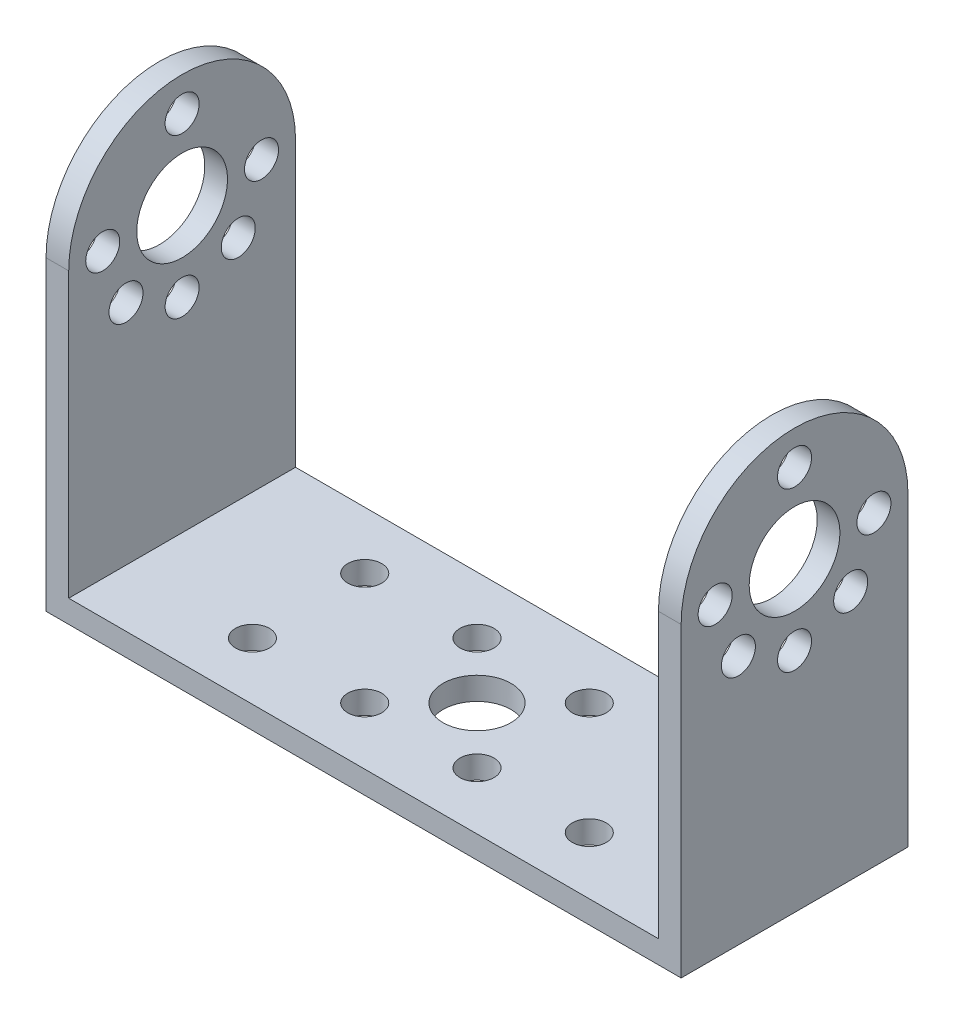
from build123d import *

# Parameters (mm, degrees)
SKETCH_1_W          = 56
SKETCH_1_H          = 20
EXTRUDE_1_DEPTH     = 2
CUT_EXTRUDE_1_REACH = 61.498
SKETCH_2_R          = 3
SKETCH_2_R_2        = 1.5
EXTRUDE_2_DEPTH     = 2
CUT_EXTRUDE_2_REACH = 72.036
SKETCH_4_R          = 4
SKETCH_4_R_2        = 1.5


with BuildPart() as part:
    # 草图1 → 凸台-拉伸1 (new body)
    with BuildSketch(Plane(origin=(0, 0, 0), x_dir=(1, 0, 0), z_dir=(0, 1, 0))):
        with Locations((28, 10)):
            Rectangle(SKETCH_1_W, SKETCH_1_H)
    extrude(amount=EXTRUDE_1_DEPTH)

    # 草图2 → 切除-拉伸1 (cut, up to next)
    with BuildSketch(Plane(origin=(0, 2, 0), x_dir=(1, 0, 0), z_dir=(0, 1, 0)), mode=Mode.PRIVATE) as cut_extrude_1_sk1:
        with Locations((28, 10)):
            Circle(SKETCH_2_R)
    cut_extrude_1_tool1 = extrude(cut_extrude_1_sk1.sketch, amount=-CUT_EXTRUDE_1_REACH, mode=Mode.PRIVATE) & part.part
    # 草图2 → 切除-拉伸1 (cut, up to next)
    with BuildSketch(Plane(origin=(0, 2, 0), x_dir=(1, 0, 0), z_dir=(0, 1, 0)), mode=Mode.PRIVATE) as cut_extrude_1_sk2:
        with Locations((32.949747468, 5.050252532)):
            Circle(SKETCH_2_R_2)
    cut_extrude_1_tool2 = extrude(cut_extrude_1_sk2.sketch, amount=-CUT_EXTRUDE_1_REACH, mode=Mode.PRIVATE) & part.part
    # 草图2 → 切除-拉伸1 (cut, up to next)
    with BuildSketch(Plane(origin=(0, 2, 0), x_dir=(1, 0, 0), z_dir=(0, 1, 0)), mode=Mode.PRIVATE) as cut_extrude_1_sk3:
        with Locations((23.050252532, 5.050252532)):
            Circle(SKETCH_2_R_2)
    cut_extrude_1_tool3 = extrude(cut_extrude_1_sk3.sketch, amount=-CUT_EXTRUDE_1_REACH, mode=Mode.PRIVATE) & part.part
    # 草图2 → 切除-拉伸1 (cut, up to next)
    with BuildSketch(Plane(origin=(0, 2, 0), x_dir=(1, 0, 0), z_dir=(0, 1, 0)), mode=Mode.PRIVATE) as cut_extrude_1_sk4:
        with Locations((23.050252532, 14.949747468)):
            Circle(SKETCH_2_R_2)
    cut_extrude_1_tool4 = extrude(cut_extrude_1_sk4.sketch, amount=-CUT_EXTRUDE_1_REACH, mode=Mode.PRIVATE) & part.part
    # 草图2 → 切除-拉伸1 (cut, up to next)
    with BuildSketch(Plane(origin=(0, 2, 0), x_dir=(1, 0, 0), z_dir=(0, 1, 0)), mode=Mode.PRIVATE) as cut_extrude_1_sk5:
        with Locations((32.949747468, 14.949747468)):
            Circle(SKETCH_2_R_2)
    cut_extrude_1_tool5 = extrude(cut_extrude_1_sk5.sketch, amount=-CUT_EXTRUDE_1_REACH, mode=Mode.PRIVATE) & part.part
    # 草图2 → 切除-拉伸1 (cut, up to next)
    with BuildSketch(Plane(origin=(0, 2, 0), x_dir=(1, 0, 0), z_dir=(0, 1, 0)), mode=Mode.PRIVATE) as cut_extrude_1_sk6:
        with Locations((13.150757595, 14.949747468)):
            Circle(SKETCH_2_R_2)
    cut_extrude_1_tool6 = extrude(cut_extrude_1_sk6.sketch, amount=-CUT_EXTRUDE_1_REACH, mode=Mode.PRIVATE) & part.part
    # 草图2 → 切除-拉伸1 (cut, up to next)
    with BuildSketch(Plane(origin=(0, 2, 0), x_dir=(1, 0, 0), z_dir=(0, 1, 0)), mode=Mode.PRIVATE) as cut_extrude_1_sk7:
        with Locations((13.150757595, 5.050252532)):
            Circle(SKETCH_2_R_2)
    cut_extrude_1_tool7 = extrude(cut_extrude_1_sk7.sketch, amount=-CUT_EXTRUDE_1_REACH, mode=Mode.PRIVATE) & part.part
    # 草图2 → 切除-拉伸1 (cut, up to next)
    with BuildSketch(Plane(origin=(0, 2, 0), x_dir=(1, 0, 0), z_dir=(0, 1, 0)), mode=Mode.PRIVATE) as cut_extrude_1_sk8:
        with Locations((42.849242405, 5.050252532)):
            Circle(SKETCH_2_R_2)
    cut_extrude_1_tool8 = extrude(cut_extrude_1_sk8.sketch, amount=-CUT_EXTRUDE_1_REACH, mode=Mode.PRIVATE) & part.part
    # 草图2 → 切除-拉伸1 (cut, up to next)
    with BuildSketch(Plane(origin=(0, 2, 0), x_dir=(1, 0, 0), z_dir=(0, 1, 0)), mode=Mode.PRIVATE) as cut_extrude_1_sk9:
        with Locations((42.849242405, 14.949747468)):
            Circle(SKETCH_2_R_2)
    cut_extrude_1_tool9 = extrude(cut_extrude_1_sk9.sketch, amount=-CUT_EXTRUDE_1_REACH, mode=Mode.PRIVATE) & part.part
    add(cut_extrude_1_tool1.solids().sort_by_distance((28, 2, -10))[0], mode=Mode.SUBTRACT)
    add(cut_extrude_1_tool2.solids().sort_by_distance((32.949747, 2, -5.050253))[0], mode=Mode.SUBTRACT)
    add(cut_extrude_1_tool3.solids().sort_by_distance((23.050253, 2, -5.050253))[0], mode=Mode.SUBTRACT)
    add(cut_extrude_1_tool4.solids().sort_by_distance((23.050253, 2, -14.949747))[0], mode=Mode.SUBTRACT)
    add(cut_extrude_1_tool5.solids().sort_by_distance((32.949747, 2, -14.949747))[0], mode=Mode.SUBTRACT)
    add(cut_extrude_1_tool6.solids().sort_by_distance((13.150758, 2, -14.949747))[0], mode=Mode.SUBTRACT)
    add(cut_extrude_1_tool7.solids().sort_by_distance((13.150758, 2, -5.050253))[0], mode=Mode.SUBTRACT)
    add(cut_extrude_1_tool8.solids().sort_by_distance((42.849242, 2, -5.050253))[0], mode=Mode.SUBTRACT)
    add(cut_extrude_1_tool9.solids().sort_by_distance((42.849242, 2, -14.949747))[0], mode=Mode.SUBTRACT)

    # 草图3 → 凸台-拉伸2 (add)
    with BuildSketch(Plane.ZY):
        with BuildLine():
            Line((-20, 2), (0, 2))
            Line((0, 2), (0, 27))
            ThreePointArc((0, 27), (-10, 37), (-20, 27))
            Line((-20, 27), (-20, 2))
        make_face()
    extrude_2 = extrude(amount=-EXTRUDE_2_DEPTH)

    # 草图4 → 切除-拉伸2 (cut, up to next)
    with BuildSketch(Plane.ZY, mode=Mode.PRIVATE) as cut_extrude_2_sk1:
        with Locations((-10, 27)):
            Circle(SKETCH_4_R)
    cut_extrude_2_tool1 = extrude(cut_extrude_2_sk1.sketch, amount=-CUT_EXTRUDE_2_REACH, mode=Mode.PRIVATE) & part.part
    # 草图4 → 切除-拉伸2 (cut, up to next)
    with BuildSketch(Plane.ZY, mode=Mode.PRIVATE) as cut_extrude_2_sk2:
        with Locations((-10, 34)):
            Circle(SKETCH_4_R_2)
    cut_extrude_2_tool2 = extrude(cut_extrude_2_sk2.sketch, amount=-CUT_EXTRUDE_2_REACH, mode=Mode.PRIVATE) & part.part
    # 草图4 → 切除-拉伸2 (cut, up to next)
    with BuildSketch(Plane.ZY, mode=Mode.PRIVATE) as cut_extrude_2_sk3:
        with Locations((-3, 27)):
            Circle(SKETCH_4_R_2)
    cut_extrude_2_tool3 = extrude(cut_extrude_2_sk3.sketch, amount=-CUT_EXTRUDE_2_REACH, mode=Mode.PRIVATE) & part.part
    # 草图4 → 切除-拉伸2 (cut, up to next)
    with BuildSketch(Plane.ZY, mode=Mode.PRIVATE) as cut_extrude_2_sk4:
        with Locations((-5.050252532, 22.050252532)):
            Circle(SKETCH_4_R_2)
    cut_extrude_2_tool4 = extrude(cut_extrude_2_sk4.sketch, amount=-CUT_EXTRUDE_2_REACH, mode=Mode.PRIVATE) & part.part
    # 草图4 → 切除-拉伸2 (cut, up to next)
    with BuildSketch(Plane.ZY, mode=Mode.PRIVATE) as cut_extrude_2_sk5:
        with Locations((-10, 20)):
            Circle(SKETCH_4_R_2)
    cut_extrude_2_tool5 = extrude(cut_extrude_2_sk5.sketch, amount=-CUT_EXTRUDE_2_REACH, mode=Mode.PRIVATE) & part.part
    # 草图4 → 切除-拉伸2 (cut, up to next)
    with BuildSketch(Plane.ZY, mode=Mode.PRIVATE) as cut_extrude_2_sk6:
        with Locations((-14.949747468, 22.050252532)):
            Circle(SKETCH_4_R_2)
    cut_extrude_2_tool6 = extrude(cut_extrude_2_sk6.sketch, amount=-CUT_EXTRUDE_2_REACH, mode=Mode.PRIVATE) & part.part
    # 草图4 → 切除-拉伸2 (cut, up to next)
    with BuildSketch(Plane.ZY, mode=Mode.PRIVATE) as cut_extrude_2_sk7:
        with Locations((-17, 27)):
            Circle(SKETCH_4_R_2)
    cut_extrude_2_tool7 = extrude(cut_extrude_2_sk7.sketch, amount=-CUT_EXTRUDE_2_REACH, mode=Mode.PRIVATE) & part.part
    cut_extrude_2_1 = cut_extrude_2_tool1.solids().sort_by_distance((0, 27, -10))[0]
    add(cut_extrude_2_1, mode=Mode.SUBTRACT)
    cut_extrude_2_2 = cut_extrude_2_tool2.solids().sort_by_distance((0, 34, -10))[0]
    add(cut_extrude_2_2, mode=Mode.SUBTRACT)
    cut_extrude_2_3 = cut_extrude_2_tool3.solids().sort_by_distance((0, 27, -3))[0]
    add(cut_extrude_2_3, mode=Mode.SUBTRACT)
    cut_extrude_2_4 = cut_extrude_2_tool4.solids().sort_by_distance((0, 22.050253, -5.050253))[0]
    add(cut_extrude_2_4, mode=Mode.SUBTRACT)
    cut_extrude_2_5 = cut_extrude_2_tool5.solids().sort_by_distance((0, 20, -10))[0]
    add(cut_extrude_2_5, mode=Mode.SUBTRACT)
    cut_extrude_2_6 = cut_extrude_2_tool6.solids().sort_by_distance((0, 22.050253, -14.949747))[0]
    add(cut_extrude_2_6, mode=Mode.SUBTRACT)
    cut_extrude_2_7 = cut_extrude_2_tool7.solids().sort_by_distance((0, 27, -17))[0]
    add(cut_extrude_2_7, mode=Mode.SUBTRACT)
    cut_extrude_2 = cut_extrude_2_1 + cut_extrude_2_2 + cut_extrude_2_3 + cut_extrude_2_4 + cut_extrude_2_5 + cut_extrude_2_6 + cut_extrude_2_7  # 切除-拉伸2 as one shape, for the pattern or mirror that repeats it

    # 镜向1: 凸台-拉伸2, 切除-拉伸2 across plane
    add(extrude_2.mirror(Plane.ZY.offset(-28)))
    add(cut_extrude_2.mirror(Plane.ZY.offset(-28)), mode=Mode.SUBTRACT)


solid = part.part
